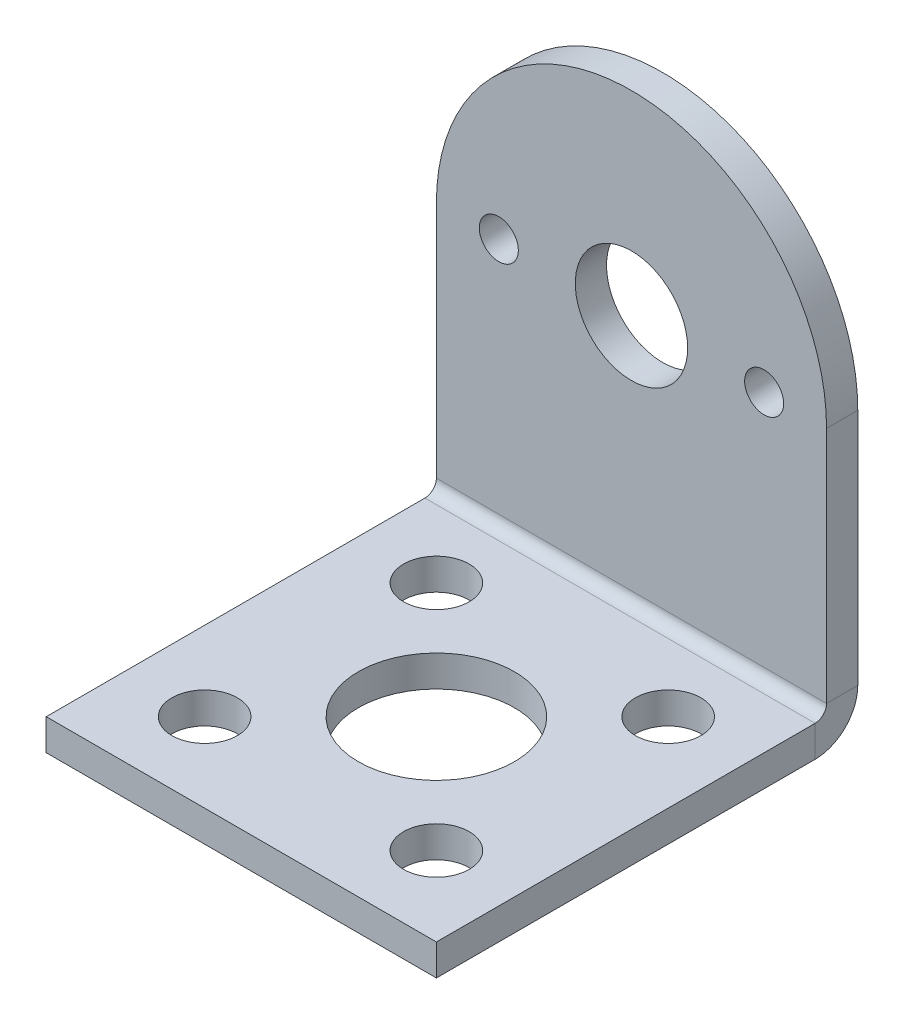
from build123d import *

# Parameters (mm, degrees)
SKETCH_1_R                       = 3.6
SKETCH_1_R_2                     = 1.25
SM_BASE_FLANGE_1_DEPTH           = 2
SM_EDGE_FLANGE_1_STRIP_W         = 9.4732
SM_EDGE_FLANGE_1_STRIP_H         = 2
SM_EDGE_FLANGE_1_STRIP_CUT_DEPTH = 25
SM_EDGE_FLANGE_1_DEPTH           = 25
SM_EDGE_FLANGE_1_PROFILE_W       = 25
SM_EDGE_FLANGE_1_PROFILE_H       = 24.2634
SM_EDGE_FLANGE_1_PROFILE_R       = 2.1
SM_EDGE_FLANGE_1_PROFILE_R_2     = 5
SM_EDGE_FLANGE_1_FLAT_DEPTH      = 2


# Sheet-metal steps are written as plain solids
with BuildPart() as part:
    # Sketch 1 → 基体-法兰1 (new body)
    with BuildSketch(Plane.XY):
        with BuildLine():
            Line((12.5, 0), (-12.5, 0))
            Line((-12.5, 0), (-12.5, 18))
            ThreePointArc((-12.5, 18), (0, 30.5), (12.5, 18))
            Line((12.5, 18), (12.5, 0))
        make_face()
        with Locations((0, 18)):
            Circle(SKETCH_1_R, mode=Mode.SUBTRACT)
        with Locations((-8.5, 18)):
            Circle(SKETCH_1_R_2, mode=Mode.SUBTRACT)
        with Locations(Location((8.5, 18, 0), (0, 0, 180))):
            Circle(SKETCH_1_R_2, mode=Mode.SUBTRACT)
    extrude(amount=-SM_BASE_FLANGE_1_DEPTH)

    # 边线-法兰1 strip (across the edge) → 边线-法兰1 strip cut (cut)
    with BuildSketch(Plane.YZ.offset(-12.5)):
        with Locations((-2, -1)):
            Rectangle(SM_EDGE_FLANGE_1_STRIP_W, SM_EDGE_FLANGE_1_STRIP_H)
    extrude(amount=SM_EDGE_FLANGE_1_STRIP_CUT_DEPTH, mode=Mode.SUBTRACT)

    # 边线-法兰1 bend section (across the edge) → 边线-法兰1 (add)
    with BuildSketch(Plane.YZ.offset(-12.5)):
        with BuildLine():
            Line((0, 0.7366), (2, 0.7366))
            ThreePointArc((2, 0.7366), (2.215745145, 0.215745145), (2.7366, 0))
            Line((2.7366, 0), (2.7366, -2))
            ThreePointArc((2.7366, -2), (0.801531583, -1.198468417), (0, 0.7366))
        make_face()
    extrude(amount=SM_EDGE_FLANGE_1_DEPTH)

    # 边线-法兰1 profile (on flange) → 边线-法兰1 flat (add)
    with BuildSketch(Plane.XZ):
        with Locations((0, 12.8683)):
            Rectangle(SM_EDGE_FLANGE_1_PROFILE_W, SM_EDGE_FLANGE_1_PROFILE_H)
        with Locations((-7.425, 5.075)):
            Circle(SM_EDGE_FLANGE_1_PROFILE_R, mode=Mode.SUBTRACT)
        with Locations((7.425, 5.075)):
            Circle(SM_EDGE_FLANGE_1_PROFILE_R, mode=Mode.SUBTRACT)
        with Locations((-7.425, 19.925)):
            Circle(SM_EDGE_FLANGE_1_PROFILE_R, mode=Mode.SUBTRACT)
        with Locations((0, 12.5)):
            Circle(SM_EDGE_FLANGE_1_PROFILE_R_2, mode=Mode.SUBTRACT)
        with Locations((7.425, 19.925)):
            Circle(SM_EDGE_FLANGE_1_PROFILE_R, mode=Mode.SUBTRACT)
    extrude(amount=-SM_EDGE_FLANGE_1_FLAT_DEPTH)


solid = part.part
